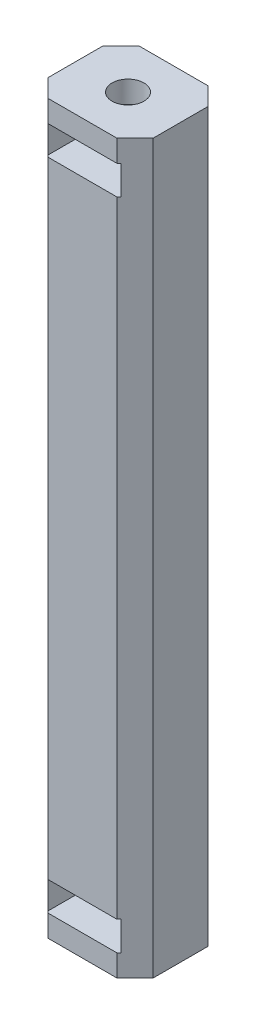
from build123d import *

# Parameters (mm, degrees)
SKETCH_1_W              = 5.773502692
SKETCH_1_H              = 5
EXTRUDE_1_DEPTH         = 40
M2_2X0_45_1_D           = 1.75
M2_2X0_45_1_ON_FACE_2_D = 1.75
CUT_EXTRUDE_1_DEPTH     = 0.8
CUT_EXTRUDE_2_DEPTH     = 0.8
CHAMFER_1_SIZE          = 1


with BuildPart() as part:
    # 草图1 → 凸台-拉伸1 (new body)
    with BuildSketch(Plane(origin=(0, 0, 0), x_dir=(1, 0, 0), z_dir=(0, 1, 0))):
        Rectangle(SKETCH_1_W, SKETCH_1_H)
    extrude(amount=EXTRUDE_1_DEPTH)

    # M2.2x0.45 螺纹孔1 (through all)
    with Locations(Plane(origin=(0, 0, 0), x_dir=(0, 0, -1), z_dir=(0, -1, 0))):
        with Locations((0, 0)):
            Hole(M2_2X0_45_1_D / 2)

    # M2.2x0.45 螺纹孔1 on face 2 (through all)
    with Locations(Plane.ZX.offset(40)):
        with Locations((0, 0)):
            Hole(M2_2X0_45_1_ON_FACE_2_D / 2)

    # 草图5 → 切除-拉伸1 (cut, symmetric)
    with BuildSketch(Plane(origin=(0, 2, 0), x_dir=(-1, 0, 0), z_dir=(0, -1, 0))):
        Polygon((-2, -1.154700538), (-2, -2.5), (2, -2.5), (2, -1.154700538), (2, 1.154700538), (0, 2.309401077), (-2, 1.154700538), align=None)
    extrude(amount=CUT_EXTRUDE_1_DEPTH, both=True, mode=Mode.SUBTRACT)

    # 草图6 → 切除-拉伸2 (cut, symmetric)
    with BuildSketch(Plane(origin=(0, 38, 0), x_dir=(1, 0, 0), z_dir=(0, 1, 0))):
        Polygon((2, -2.5), (2, -1.154700538), (2, 1.154700538), (0, 2.309401077), (-2, 1.154700538), (-2, -1.154700538), (-2, -2.5), align=None)
    extrude(amount=CUT_EXTRUDE_2_DEPTH, both=True, mode=Mode.SUBTRACT)

    # 倒角1
    # the kernel refuses this chamfer: 1 mm, written as the material it takes off along each edge
    with BuildSketch(Plane(origin=(-2.886751346, -2.571682988, 2.5), x_dir=(-0.027495876610586494, 0, -0.9996219169112968), z_dir=(0, 1, 0)), Plane(origin=(2.886751346, -2.571682988, 2.5), x_dir=(-0.9996219169112965, 0, 0.027495876610591666), z_dir=(0, 1, 0))) as chamfer_1_piece_1:
        Polygon((CHAMFER_1_SIZE * 0.999621916911, -CHAMFER_1_SIZE * 0.0274958766106), (-CHAMFER_1_SIZE * 0.0274958766106, -CHAMFER_1_SIZE * 0.999621916911), (0, 0), align=None)
    extrude(amount=45.143365976, mode=Mode.SUBTRACT)
    with BuildSketch(Plane(origin=(-2.886751346, -2.571682988, -2.5), x_dir=(-0.027495876610586487, 0, 0.9996219169112968), z_dir=(0, 1, 0)), Plane(origin=(2.886751346, -2.571682988, -2.5), x_dir=(-0.9996219169112968, 0, -0.02749587661058476), z_dir=(0, 1, 0))) as chamfer_1_piece_2:
        Polygon((CHAMFER_1_SIZE * 0.999621916911, CHAMFER_1_SIZE * 0.0274958766106), (-CHAMFER_1_SIZE * 0.0274958766106, CHAMFER_1_SIZE * 0.999621916911), (0, 0), align=None)
    extrude(amount=45.143365976, mode=Mode.SUBTRACT)


solid = part.part
